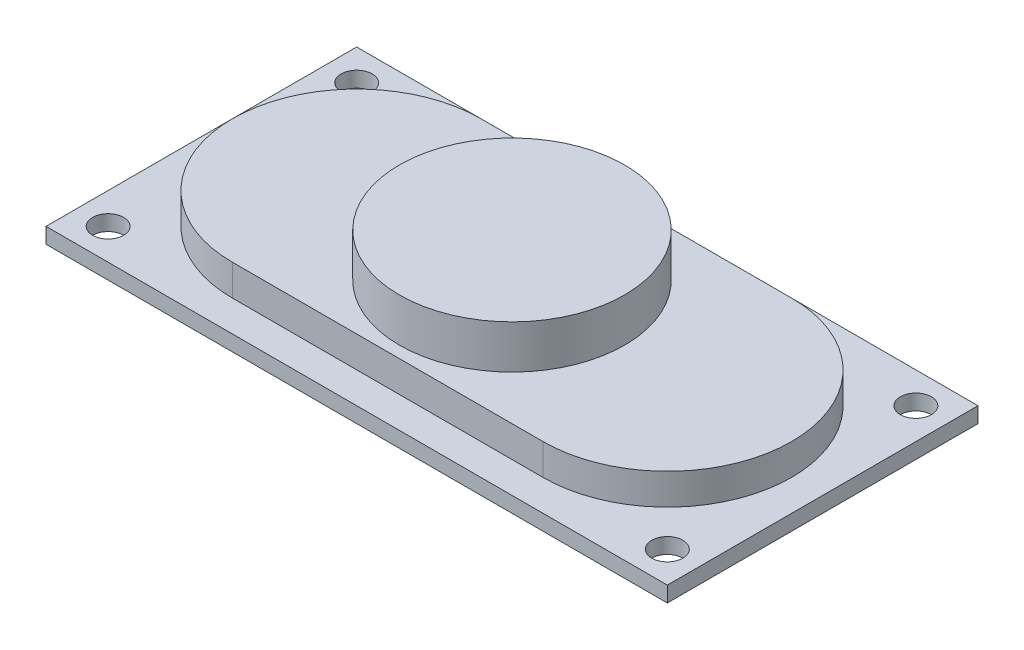
from build123d import *

# Parameters (mm, degrees)
SKETCH_1_W          = 40
SKETCH_1_H          = 20
EXTRUDE_1_DEPTH     = 1
SKETCH_2_R          = 1
CUT_EXTRUDE_1_DEPTH = 1
EXTRUDE_2_DEPTH     = 2
SHELL_2_DEPTH       = 2
SKETCH_4_R          = 7.25
EXTRUDE_3_DEPTH     = 2.8


# Read off the part's stored shape, not the designer's step: 抽壳2
with BuildPart() as part:
    # 草图1 → 凸台-拉伸1 (new body)
    with BuildSketch(Plane(origin=(0, 0, 0), x_dir=(1, 0, 0), z_dir=(0, 1, 0))):
        Rectangle(SKETCH_1_W, SKETCH_1_H)
    extrude(amount=EXTRUDE_1_DEPTH)

    # 草图2 → 切除-拉伸1 (cut)
    with BuildSketch(Plane(origin=(0, 1, 0), x_dir=(1, 0, 0), z_dir=(0, 1, 0))):
        with Locations(Location((-18, 8, 0), (0, 0, 270))):
            Circle(SKETCH_2_R)
        with Locations(Location((18, 8, 0), (0, 0, 90))):
            Circle(SKETCH_2_R)
        with Locations(Location((18, -8, 0), (0, 0, 270))):
            Circle(SKETCH_2_R)
        with Locations(Location((-18, -8, 0), (0, 0, 90))):
            Circle(SKETCH_2_R)
    extrude(amount=-CUT_EXTRUDE_1_DEPTH, mode=Mode.SUBTRACT)

    # 草图3 → 凸台-拉伸2 (add)
    with BuildSketch(Plane(origin=(0, 1, 0), x_dir=(1, 0, 0), z_dir=(0, 1, 0))):
        with BuildLine():
            Line((-10, 8), (10, 8))
            ThreePointArc((10, 8), (18, 0), (10, -8))
            Line((10, -8), (-10, -8))
            ThreePointArc((-10, -8), (-18, 0), (-10, 8))
        make_face()
    extrude(amount=EXTRUDE_2_DEPTH)

    # 抽壳2 outline → 抽壳2 (cut)
    with BuildSketch(Plane(origin=(0, 0, 0), x_dir=(1, 0, 0), z_dir=(0, 1, 0))):
        with BuildLine():
            ThreePointArc((-10, 7), (-17, 0), (-10, -7))
            Line((-10, -7), (10, -7))
            ThreePointArc((10, -7), (17, 0), (10, 7))
            Line((10, 7), (-10, 7))
        make_face()
    extrude(amount=SHELL_2_DEPTH, mode=Mode.SUBTRACT)

    # 草图4 → 凸台-拉伸3 (add)
    with BuildSketch(Plane(origin=(0, 3, 0), x_dir=(1, 0, 0), z_dir=(0, 1, 0))):
        with Locations(Location((0, 0, 0), (0, 0, 270))):
            Circle(SKETCH_4_R)
    extrude(amount=EXTRUDE_3_DEPTH)


solid = part.part
